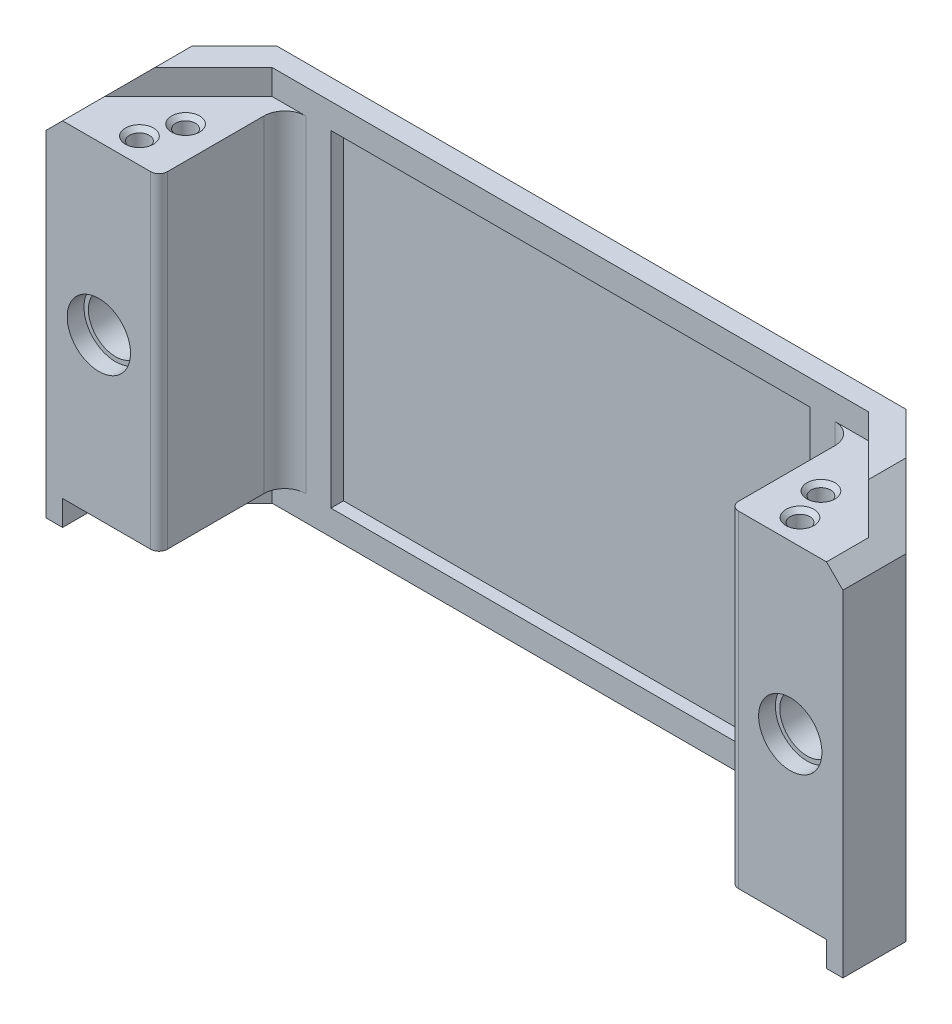
from build123d import *

# Parameters (mm, degrees)
SKETCH1_W                      = 190
SKETCH1_H                      = 90
BOSS_EXTRUDE1_DEPTH            = 5
SKETCH2_W                      = 3.9
SKETCH2_H                      = 90
BOSS_EXTRUDE2_DEPTH            = 30
SKETCH3_W                      = 34
SKETCH3_H                      = 5
SKETCH3_W_2                    = 47
BOSS_EXTRUDE3_DEPTH            = 90
SKETCH4_W                      = 182.2
SKETCH4_H                      = 6
CUT_EXTRUDE1_DEPTH             = 5
CHAMFER6_SIZE                  = 20
BOSS_EXTRUDE4_DEPTH            = 78
FILLET5_R                      = 2
SKETCH9_R                      = 6.5
CUT_EXTRUDE4_DEPTH             = 10
SKETCH10_R                     = 7.55
CUT_EXTRUDE5_DEPTH             = 4
SKETCH15_R                     = 2.35
CUT_EXTRUDE7_DEPTH             = 8
CHAMFER7_SIZE                  = 1
SKETCH17_R                     = 6.1
CUT_EXTRUDE8_DEPTH             = 3.2
FILLET7_R                      = 0.2
CHAMFER8_SIZE                  = 9.9
CUT_EXTRUDE9_REACH             = 164.433
SKETCH18_W                     = 5
SKETCH18_H                     = 78
CUT_EXTRUDE9_DIRECTION_2_REACH = 164.433
BOSS_EXTRUDE5_DEPTH            = 78
FILLET8_R                      = 5
SKETCH21_W                     = 114.2
SKETCH21_H                     = 78
CUT_EXTRUDE10_DEPTH            = 3


with BuildPart() as part:
    # Sketch1 → Boss-Extrude1 (new body)
    with BuildSketch(Plane.XY):
        Rectangle(SKETCH1_W, SKETCH1_H)
    extrude(amount=BOSS_EXTRUDE1_DEPTH)

    # Sketch2 → Boss-Extrude2 (add)
    with BuildSketch(Plane.XY.offset(5)):
        with Locations((-93.05, 0)):
            Rectangle(SKETCH2_W, SKETCH2_H)
        with Locations((93.05, 0)):
            Rectangle(SKETCH2_W, SKETCH2_H)
    extrude(amount=BOSS_EXTRUDE2_DEPTH)

    # Sketch3 → Boss-Extrude3 (add)
    with BuildSketch(Plane(origin=(0, 45, 0), x_dir=(1, 0, 0), z_dir=(0, 1, 0))):
        with Locations((-74.1, -16.5)):
            Rectangle(SKETCH3_W, SKETCH3_H)
        with Locations((67.6, -16.5)):
            Rectangle(SKETCH3_W_2, SKETCH3_H)
    extrude(amount=-BOSS_EXTRUDE3_DEPTH)

    # Sketch4 → Cut-Extrude1 (cut)
    with BuildSketch(Plane.XY.offset(19)):
        with Locations((0, 42)):
            Rectangle(SKETCH4_W, SKETCH4_H)
        with Locations((0, -42)):
            Rectangle(SKETCH4_W, SKETCH4_H)
    extrude(amount=-CUT_EXTRUDE1_DEPTH, mode=Mode.SUBTRACT)

    # Chamfer6
    # the kernel refuses this chamfer: 20 mm, written as the material it adds along each edge
    with BuildSketch(Plane(origin=(-91.1, 45, 5), x_dir=(0.9996219169112968, 0, -0.02749587661058636), z_dir=(0, -1, 0))) as chamfer6_piece_1:
        Polygon((CHAMFER6_SIZE * 0.999621916911, CHAMFER6_SIZE * 0.0274958766106), (-CHAMFER6_SIZE * 0.0274958766106, CHAMFER6_SIZE * 0.999621916911), (0, 0), align=None)
    extrude(amount=90)
    with BuildSketch(Plane(origin=(91.1, -45, 5), x_dir=(0.027495876610586317, 0, 0.9996219169112968), z_dir=(0, 1, 0))) as chamfer6_piece_2:
        Polygon((CHAMFER6_SIZE * 0.999621916911, -CHAMFER6_SIZE * 0.0274958766106), (-CHAMFER6_SIZE * 0.0274958766106, -CHAMFER6_SIZE * 0.999621916911), (0, 0), align=None)
    extrude(amount=90)
    # the kernel refuses this chamfer: 20 mm, written as the material it takes off along each edge
    with BuildSketch(Plane(origin=(-95, -96.433659759, 0), x_dir=(0.9996219169112968, 0, -0.027495876610586372), z_dir=(0, 1, 0)), Plane(origin=(95, 96.433659759, 0), x_dir=(-0.9996219169112968, 0, -0.027495876610586372), z_dir=(0, -1, 0))) as chamfer6_2_piece_1:
        Polygon((CHAMFER6_SIZE * 0.999621916911, -CHAMFER6_SIZE * 0.0274958766106), (-CHAMFER6_SIZE * 0.0274958766106, -CHAMFER6_SIZE * 0.999621916911), (0, 0), align=None)
    extrude(amount=192.867319519, mode=Mode.SUBTRACT)

    # Sketch7 → Boss-Extrude4 (add)
    with BuildSketch(Plane(origin=(0, 39, 0), x_dir=(1, 0, 0), z_dir=(0, 1, 0))):
        Polygon((-85.1, -19), (-91.1, -25), (-91.1, -35), (-68.1, -35), (-68.1, -19), align=None)
        Polygon((68.1, -35), (68.1, -19), (85.1, -19), (91.1, -25), (91.1, -35), align=None)
    extrude(amount=-BOSS_EXTRUDE4_DEPTH)

    # Fillet5
    fillet5_edges = [part.edges().sort_by_distance(p)[0] for p in [
        (-68.1, 0, 35),
        (68.1, 0, 35),
    ]]
    fillet(fillet5_edges, radius=FILLET5_R)

    # Sketch9 → Cut-Extrude4 (cut)
    with BuildSketch(Plane.XY.offset(35)):
        with Locations((-82.45, -0.90743758)):
            Circle(SKETCH9_R)
        with Locations(Location((82.45, -0.90743758, 0), (0, 0, 180))):
            Circle(SKETCH9_R)
    extrude(amount=-CUT_EXTRUDE4_DEPTH, mode=Mode.SUBTRACT)

    # Sketch10 → Cut-Extrude5 (cut)
    with BuildSketch(Plane.XY.offset(35)):
        with Locations((-82.45, -0.90743758)):
            Circle(SKETCH10_R)
        with Locations((82.45, -0.90743758)):
            Circle(SKETCH10_R)
    extrude(amount=-CUT_EXTRUDE5_DEPTH, mode=Mode.SUBTRACT)

    # Sketch15 → Cut-Extrude7 (cut)
    with BuildSketch(Plane(origin=(0, 39, 0), x_dir=(1, 0, 0), z_dir=(0, 1, 0))):
        with Locations(Location((75.766666667, -21, 0), (0, 0, 270))):
            Circle(SKETCH15_R)
        with Locations(Location((-75.766666667, -21, 0), (0, 0, 90))):
            Circle(SKETCH15_R)
        with Locations(Location((78.766666667, -29, 0), (0, 0, 270))):
            Circle(SKETCH15_R)
        with Locations(Location((-78.766666667, -29, 0), (0, 0, 90))):
            Circle(SKETCH15_R)
    extrude(amount=-CUT_EXTRUDE7_DEPTH, mode=Mode.SUBTRACT)

    # Chamfer7
    chamfer7_edges = [part.edges().sort_by_distance(p)[0] for p in [
        (-75.766666667, 39, 23.35),
        (78.766666667, 39, 26.65),
        (-78.766666667, 39, 31.35),
        (75.766666667, 39, 18.65),
    ]]
    chamfer(chamfer7_edges, length=CHAMFER7_SIZE)

    # Sketch17 → Cut-Extrude8 (cut)
    with BuildSketch(Plane.XZ.offset(39)):
        with Locations((79.6, 27)):
            Circle(SKETCH17_R)
        with Locations(Location((-79.6, 27, 0), (0, 0, 180))):
            Circle(SKETCH17_R)
    extrude(amount=-CUT_EXTRUDE8_DEPTH, mode=Mode.SUBTRACT)

    # Fillet7
    fillet7_edges = [part.edges().sort_by_distance(p)[0] for p in [
        (73.5, -39, 27),
        (-73.5, -39, 27),
    ]]
    fillet(fillet7_edges, radius=FILLET7_R)

    # Chamfer8
    # the kernel refuses this chamfer: 9.9 mm, written as the material it takes off along each edge
    with BuildSketch(Plane(origin=(-95, 45, -5.459661581), x_dir=(0.9996219169112968, 0.027495876610586265, 0), z_dir=(0, 0, 1)), Plane(origin=(95, 45, 60.459661581), x_dir=(-0.9996219169112968, 0.02749587661058615, 0), z_dir=(0, 0, -1))) as chamfer8_piece_1:
        Polygon((CHAMFER8_SIZE * 0.999621916911, -CHAMFER8_SIZE * 0.0274958766106), (-CHAMFER8_SIZE * 0.0274958766106, -CHAMFER8_SIZE * 0.999621916911), (0, 0), align=None)
    extrude(amount=65.919323162, mode=Mode.SUBTRACT)

    # Cut-Extrude9: up to this face of the body (flat: up to its plane)
    cut_extrude9_end = Plane(part.part.faces().sort_by_distance((-68.1, 0, 26))[0])
    # Sketch18 → Cut-Extrude9 (cut, up to the picked face)
    with BuildSketch(Plane(origin=(-57.1, 0, 0), x_dir=(0, 0, -1), z_dir=(1, 0, 0)), mode=Mode.PRIVATE) as cut_extrude9_sk1:
        with Locations((-16.5, 0)):
            Rectangle(SKETCH18_W, SKETCH18_H)
    cut_extrude9_tool1 = split(extrude(cut_extrude9_sk1.sketch, amount=-CUT_EXTRUDE9_REACH, mode=Mode.PRIVATE), bisect_by=cut_extrude9_end, keep=Keep.BOTH, mode=Mode.PRIVATE)
    add(cut_extrude9_tool1.solids().sort_by(Axis((-57.1, 0, 16.5), (-1, 0, 0)))[0], mode=Mode.SUBTRACT)

    # Cut-Extrude9 direction 2: up to this face of the body (flat: up to its plane)
    cut_extrude9_direction_2_end = Plane(part.part.faces().sort_by_distance((68.1, 0, 26))[0])
    # Sketch18 → Cut-Extrude9 direction 2 (cut, up to the picked face)
    with BuildSketch(Plane(origin=(-57.1, 0, 0), x_dir=(0, 0, -1), z_dir=(1, 0, 0)), mode=Mode.PRIVATE) as cut_extrude9_direction_2_sk1:
        with Locations((-16.5, 0)):
            Rectangle(SKETCH18_W, SKETCH18_H)
    cut_extrude9_direction_2_tool1 = split(extrude(cut_extrude9_direction_2_sk1.sketch, amount=CUT_EXTRUDE9_DIRECTION_2_REACH, mode=Mode.PRIVATE), bisect_by=cut_extrude9_direction_2_end, keep=Keep.BOTH, mode=Mode.PRIVATE)
    add(cut_extrude9_direction_2_tool1.solids().sort_by(Axis((-57.1, 0, 16.5), (1, 0, 0)))[0], mode=Mode.SUBTRACT)

    # Sketch20 → Boss-Extrude5 (add)
    with BuildSketch(Plane(origin=(0, 39, 0), x_dir=(1, 0, 0), z_dir=(0, 1, 0))):
        Polygon((-68.1, -14), (-68.1, -5), (-71.1, -5), (-80.1, -14), align=None)
        Polygon((71.1, -5), (80.1, -14), (68.1, -14), (68.1, -5), align=None)
    extrude(amount=-BOSS_EXTRUDE5_DEPTH)

    # Fillet8
    fillet8_edges = [part.edges().sort_by_distance(p)[0] for p in [
        (-68.1, 0, 5),
        (68.1, 0, 5),
    ]]
    fillet(fillet8_edges, radius=FILLET8_R)

    # Sketch21 → Cut-Extrude10 (cut)
    with BuildSketch(Plane.XY.offset(5)):
        Rectangle(SKETCH21_W, SKETCH21_H)
    extrude(amount=-CUT_EXTRUDE10_DEPTH, mode=Mode.SUBTRACT)


solid = part.part
